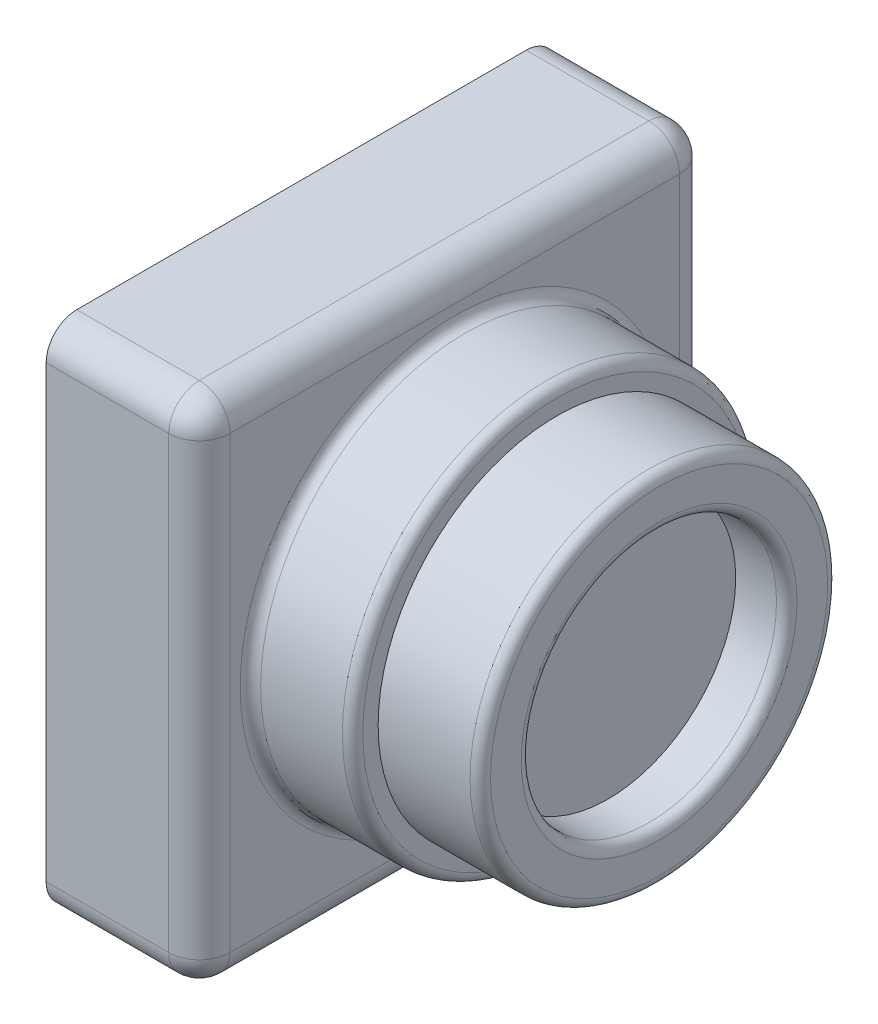
from build123d import *

# Parameters (mm, degrees)
SKETCH1_W           = 50
SKETCH1_H           = 50
BOSS_EXTRUDE1_DEPTH = 15
SKETCH2_R           = 20
BOSS_EXTRUDE2_DEPTH = 20
CUT_EXTRUDE1_START  = -10
SKETCH3_R           = 20
SKETCH3_R_2         = 17.5
SKETCH3_R_3         = 12.5
CUT_EXTRUDE1_DEPTH  = 10
SKETCH4_R           = 12.5
BOSS_EXTRUDE3_DEPTH = 5
FILLET1_R           = 1
FILLET2_R           = 3
FILLET3_R           = 3


with BuildPart() as part:
    # Sketch1 → Boss-Extrude1 (new body)
    with BuildSketch(Plane(origin=(0, 0, 0), x_dir=(0, 0, -1), z_dir=(1, 0, 0))):
        Rectangle(SKETCH1_W, SKETCH1_H)
    extrude(amount=BOSS_EXTRUDE1_DEPTH)

    # Sketch2 → Boss-Extrude2 (add)
    with BuildSketch(Plane(origin=(15, 0, 0), x_dir=(0, 0, -1), z_dir=(1, 0, 0))):
        Circle(SKETCH2_R)
    extrude(amount=BOSS_EXTRUDE2_DEPTH)

    # Sketch3 → Cut-Extrude1 (cut)
    # profile 1 of 2: a face of its own
    with BuildSketch(Plane(origin=(35, 0, 0), x_dir=(0, 0, -1), z_dir=(1, 0, 0)).offset(CUT_EXTRUDE1_START)):
        Circle(SKETCH3_R)
        Circle(SKETCH3_R_2, mode=Mode.SUBTRACT)
    # profile 2 of 2: a face of its own
    with BuildSketch(Plane(origin=(35, 0, 0), x_dir=(0, 0, -1), z_dir=(1, 0, 0)).offset(CUT_EXTRUDE1_START)):
        Circle(SKETCH3_R_3)
    extrude(amount=CUT_EXTRUDE1_DEPTH, mode=Mode.SUBTRACT)

    # Sketch4 → Boss-Extrude3 (add)
    with BuildSketch(Plane(origin=(25, 0, 0), x_dir=(0, 0, -1), z_dir=(1, 0, 0))):
        Circle(SKETCH4_R)
    extrude(amount=BOSS_EXTRUDE3_DEPTH)

    # Fillet1
    fillet1_edges = [part.edges().sort_by_distance(p)[0] for p in [
        (15, 0, 20),
        (35, 0, 12.5),
        (35, 0, 17.5),
        (25, 0, 20),
    ]]
    fillet(fillet1_edges, radius=FILLET1_R)

    # Fillet2
    fillet2_edges = [part.edges().sort_by_distance(p)[0] for p in [
        (15, 0, 25),
        (15, -25, 0),
        (15, 0, -25),
        (15, 25, 0),
    ]]
    fillet(fillet2_edges, radius=FILLET2_R)

    # Fillet3
    # the kernel refuses this fillet: 3 mm, written as the material it takes off along each edge
    with BuildSketch(Plane(origin=(12, 22, 22), x_dir=(0, 1, 0), z_dir=(0, 0, 1))) as fillet3_piece_1_section:
        Polygon((0, 0), (FILLET3_R, 0), (FILLET3_R, -FILLET3_R), (0, -FILLET3_R), align=None)
    fillet3_piece_1 = extrude(amount=FILLET3_R, mode=Mode.PRIVATE)
    fillet3_piece_1 = fillet3_piece_1 - Plane(origin=(12, 22, 22), x_dir=(-0.7071067811865475, -0.7071067811865475, 0), z_dir=(0, 0, 1)) * Sphere(FILLET3_R, mode=Mode.PRIVATE)
    add(fillet3_piece_1, mode=Mode.SUBTRACT)
    with BuildSketch(Plane(origin=(12, 22, -22), x_dir=(0, 0, -1), z_dir=(0, 1, 0))) as fillet3_piece_2_section:
        Polygon((0, 0), (FILLET3_R, 0), (FILLET3_R, -FILLET3_R), (0, -FILLET3_R), align=None)
    fillet3_piece_2 = extrude(amount=FILLET3_R, mode=Mode.PRIVATE)
    fillet3_piece_2 = fillet3_piece_2 - Plane(origin=(12, 22, -22), x_dir=(-0.7071067811865475, 0, 0.7071067811865475), z_dir=(0, 1, 0)) * Sphere(FILLET3_R, mode=Mode.PRIVATE)
    add(fillet3_piece_2, mode=Mode.SUBTRACT)
    with BuildSketch(Plane(origin=(12, -22, 22), x_dir=(0, -1, 0), z_dir=(0, 0, 1))) as fillet3_piece_3_section:
        Polygon((0, 0), (FILLET3_R, 0), (FILLET3_R, FILLET3_R), (0, FILLET3_R), align=None)
    fillet3_piece_3 = extrude(amount=FILLET3_R, mode=Mode.PRIVATE)
    fillet3_piece_3 = fillet3_piece_3 - Plane(origin=(12, -22, 22), x_dir=(-0.7071067811865475, 0.7071067811865475, 0), z_dir=(0, 0, 1)) * Sphere(FILLET3_R, mode=Mode.PRIVATE)
    add(fillet3_piece_3, mode=Mode.SUBTRACT)
    with BuildSketch(Plane(origin=(12, -22, -22), x_dir=(0, 0, -1), z_dir=(0, -1, 0))) as fillet3_piece_4_section:
        Polygon((0, 0), (FILLET3_R, 0), (FILLET3_R, FILLET3_R), (0, FILLET3_R), align=None)
    fillet3_piece_4 = extrude(amount=FILLET3_R, mode=Mode.PRIVATE)
    fillet3_piece_4 = fillet3_piece_4 - Plane(origin=(12, -22, -22), x_dir=(-0.7071067811865475, 0, 0.7071067811865475), z_dir=(0, -1, 0)) * Sphere(FILLET3_R, mode=Mode.PRIVATE)
    add(fillet3_piece_4, mode=Mode.SUBTRACT)
    with BuildSketch(Plane(origin=(-7.5, -25, -25), x_dir=(0, 0, 1), z_dir=(1, 0, 0)), Plane(origin=(-7.5, -25, 25), x_dir=(0, 1, 0), z_dir=(1, 0, 0))) as fillet3_piece_5:
        with BuildLine():
            CenterArc((FILLET3_R, -FILLET3_R), FILLET3_R, 90, 90)
            Line((0, -FILLET3_R), (0, 0))
            Line((0, 0), (FILLET3_R, 0))
        make_face()
    extrude(amount=19.5, mode=Mode.SUBTRACT)
    with BuildSketch(Plane(origin=(-7.5, 25, -25), x_dir=(0, 0, 1), z_dir=(1, 0, 0)), Plane(origin=(-7.5, 25, 25), x_dir=(0, -1, 0), z_dir=(1, 0, 0))) as fillet3_piece_6:
        with BuildLine():
            CenterArc((FILLET3_R, FILLET3_R), FILLET3_R, 180, 90)
            Line((0, FILLET3_R), (0, 0))
            Line((0, 0), (FILLET3_R, 0))
        make_face()
    extrude(amount=19.5, mode=Mode.SUBTRACT)


solid = part.part
